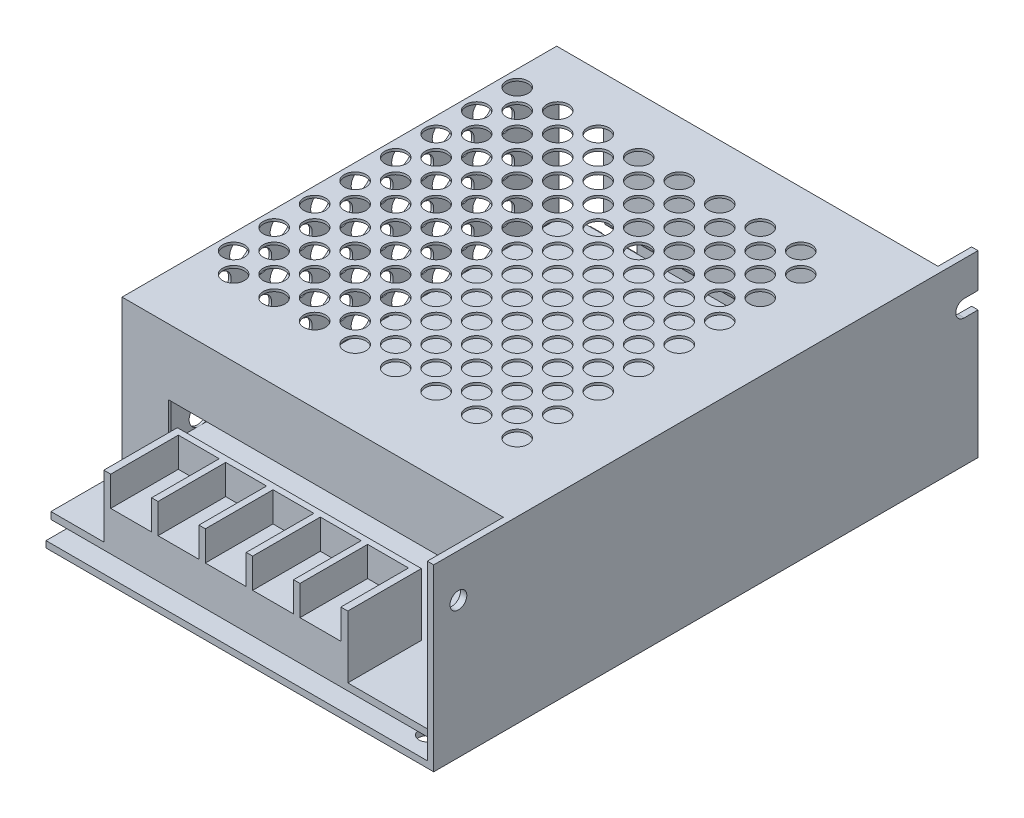
from build123d import *

# Parameters (mm, degrees)
BASE_BOSS_EXTRUDE1_DEPTH                     = 110.2
SKETCH2_R                                    = 1.7
MOUNTING_HOLES_SIDE_CUT_EXTRUDE1_DEPTH       = 1.3
SKETCH3_R                                    = 1.7
MOUNTING_HOLES_BOTTOM_CUT_EXTRUDE2_DEPTH     = 1.3
HEATSINK_BOSS_EXTRUDE2_DEPTH                 = 66.4
CHASSI_BOSS_EXTRUDE3_DEPTH                   = 88
CHASSI_FRONT_BOSS_EXTRUDE4_DEPTH             = 0.5
SKETCH7_W                                    = 76.7
SKETCH7_H                                    = 104.5
PCB_BOSS_EXTRUDE5_DEPTH                      = 1.4
SKETCH8_W                                    = 49.4
SKETCH8_H                                    = 14.9
CONNECTOR_HOUSING_BOSS_EXTRUDE6_DEPTH        = 12.6
SKETCH9_W                                    = 8.28
SKETCH9_H                                    = 13.7
CONNECTOR_SCREW_CUT_EXTRUDE3_DEPTH           = 6
SKETCH10_R                                   = 2.2
CHASSI_VENTING_HOLES_TOP_CUT_EXTRUDE5_DEPTH  = 0.5
SKETCH11_R                                   = 2.2
CHASSI_VENTING_HOLES_SIDE_CUT_EXTRUDE6_DEPTH = 0.5


with BuildPart() as part:
    # Sketch1 → Base Boss-Extrude1 (new body)
    with BuildSketch(Plane.XY):
        Polygon((0, 0), (0, 36.3), (-1.3, 36.3), (-1.3, 1.3), (-78.5, 1.3), (-78.5, 0), align=None)
    extrude(amount=-BASE_BOSS_EXTRUDE1_DEPTH)

    # Sketch2 → Mounting Holes Side Cut-Extrude1 (cut)
    with BuildSketch(Plane.ZY.offset(1.3)):
        with Locations(Location((-5, 27.6, 0), (0, 0, 270))):
            Circle(SKETCH2_R)
        with BuildLine():
            Line((-110.2, 29.3), (-107.4, 29.3))
            ThreePointArc((-107.4, 29.3), (-105.7, 27.6), (-107.4, 25.9))
            Line((-107.4, 25.9), (-110.2, 25.9))
            Line((-110.2, 25.9), (-110.2, 29.3))
        make_face()
    extrude(amount=-MOUNTING_HOLES_SIDE_CUT_EXTRUDE1_DEPTH, mode=Mode.SUBTRACT)

    # Sketch3 → Mounting Holes Bottom Cut-Extrude2 (cut)
    with BuildSketch(Plane(origin=(0, 1.3, 0), x_dir=(1, 0, 0), z_dir=(0, 1, 0))):
        with Locations(Location((-5.8, 4.5, 0), (0, 0, 180))):
            Circle(SKETCH3_R)
        with BuildLine():
            Line((-72.7, 108.5), (-72.7, 110.2))
            Line((-72.7, 110.2), (-76.1, 110.2))
            Line((-76.1, 110.2), (-76.1, 108.5))
            ThreePointArc((-76.1, 108.5), (-74.4, 106.8), (-72.7, 108.5))
        make_face()
    extrude(amount=-MOUNTING_HOLES_BOTTOM_CUT_EXTRUDE2_DEPTH, mode=Mode.SUBTRACT)

    # Sketch4 → Heatsink Boss-Extrude2 (add)
    with BuildSketch(Plane.ZY.offset(1.3)):
        with BuildLine():
            Line((-110.2, 1.3), (-108.9, 1.3))
            Line((-108.9, 1.3), (-108.9, 8.3))
            ThreePointArc((-108.9, 8.3), (-108.781448236, 8.649242235), (-108.474789595, 8.854144988))
            Line((-108.474789595, 8.854144988), (-103.488745646, 10.190151438))
            ThreePointArc((-103.488745646, 10.190151438), (-102.487192422, 10.859367907), (-102.1, 12))
            Line((-102.1, 12), (-102.1, 36.3))
            Line((-102.1, 36.3), (-103.4, 36.3))
            Line((-103.4, 36.3), (-103.4, 12))
            ThreePointArc((-103.4, 12), (-103.518551764, 11.650757765), (-103.825210405, 11.445855012))
            Line((-103.825210405, 11.445855012), (-108.811254354, 10.109848562))
            ThreePointArc((-108.811254354, 10.109848562), (-109.812807578, 9.440632093), (-110.2, 8.3))
            Line((-110.2, 8.3), (-110.2, 1.3))
        make_face()
    extrude(amount=HEATSINK_BOSS_EXTRUDE2_DEPTH)

    # Sketch5 → Chassi Boss-Extrude3 (add)
    with BuildSketch(Plane(origin=(0, 0, -103.4), x_dir=(-1, 0, 0), z_dir=(0, 0, -1))):
        Polygon((1.3, 36.3), (78.5, 36.3), (78.5, 1.3), (78, 1.3), (78, 35.8), (1.3, 35.8), align=None)
    extrude(amount=-CHASSI_BOSS_EXTRUDE3_DEPTH)

    # Sketch6 → Chassi Front Boss-Extrude4 (add)
    with BuildSketch(Plane.XY.offset(-15.4)):
        Polygon((-1.3, 36.3), (-78.5, 36.3), (-78.5, 1.3), (-69.1, 1.3), (-69.1, 23), (-1.3, 23), align=None)
    extrude(amount=-CHASSI_FRONT_BOSS_EXTRUDE4_DEPTH)

    # Sketch7 → PCB Boss-Extrude5 (add)
    with BuildSketch(Plane(origin=(0, 5, 0), x_dir=(1, 0, 0), z_dir=(0, 1, 0))):
        with Locations((-39.65, 52.75)):
            Rectangle(SKETCH7_W, SKETCH7_H)
    extrude(amount=PCB_BOSS_EXTRUDE5_DEPTH)

    # Sketch8 → Connector Housing Boss-Extrude6 (add)
    with BuildSketch(Plane(origin=(0, 6.4, 0), x_dir=(1, 0, 0), z_dir=(0, 1, 0))):
        with Locations((-42.6, 7.95)):
            Rectangle(SKETCH8_W, SKETCH8_H)
    extrude(amount=CONNECTOR_HOUSING_BOSS_EXTRUDE6_DEPTH)

    # Sketch9 → Connector Screw Cut-Extrude3 (cut)
    with BuildSketch(Plane(origin=(0, 19, 0), x_dir=(1, 0, 0), z_dir=(0, 1, 0))):
        with Locations((-61.76, 7.35)):
            Rectangle(SKETCH9_W, SKETCH9_H)
        with Locations((-52.18, 7.35)):
            Rectangle(SKETCH9_W, SKETCH9_H)
        with Locations((-42.6, 7.35)):
            Rectangle(SKETCH9_W, SKETCH9_H)
        with Locations((-33.02, 7.35)):
            Rectangle(SKETCH9_W, SKETCH9_H)
        with Locations((-23.44, 7.35)):
            Rectangle(SKETCH9_W, SKETCH9_H)
    extrude(amount=-CONNECTOR_SCREW_CUT_EXTRUDE3_DEPTH, mode=Mode.SUBTRACT)

    # Sketch10 → Chassi Venting Holes Top Cut-Extrude5 (cut)
    with BuildSketch(Plane(origin=(0, 36.3, 0), x_dir=(1, 0, 0), z_dir=(0, 1, 0))):
        with Locations(Location((-75.3, 92.2, 0), (0, 0, 270))):
            Circle(SKETCH10_R)
        with Locations(Location((-71.198780669, 88.098780669, 0), (0, 0, 270))):
            Circle(SKETCH10_R)
        with Locations(Location((-67.097561338, 92.2, 0), (0, 0, 270))):
            Circle(SKETCH10_R)
        with Locations(Location((-62.996342007, 88.098780669, 0), (0, 0, 270))):
            Circle(SKETCH10_R)
        with Locations(Location((-58.895122676, 92.2, 0), (0, 0, 270))):
            Circle(SKETCH10_R)
        with Locations(Location((-54.793903346, 88.098780669, 0), (0, 0, 270))):
            Circle(SKETCH10_R)
        with Locations(Location((-50.692684015, 92.2, 0), (0, 0, 270))):
            Circle(SKETCH10_R)
        with Locations(Location((-46.591464684, 88.098780669, 0), (0, 0, 270))):
            Circle(SKETCH10_R)
        with Locations(Location((-42.490245353, 92.2, 0), (0, 0, 270))):
            Circle(SKETCH10_R)
        with Locations(Location((-38.389026022, 88.098780669, 0), (0, 0, 270))):
            Circle(SKETCH10_R)
        with Locations(Location((-34.287806691, 92.2, 0), (0, 0, 270))):
            Circle(SKETCH10_R)
        with Locations(Location((-30.18658736, 88.098780669, 0), (0, 0, 270))):
            Circle(SKETCH10_R)
        with Locations(Location((-26.085368029, 92.2, 0), (0, 0, 270))):
            Circle(SKETCH10_R)
        with Locations(Location((-21.984148699, 88.098780669, 0), (0, 0, 270))):
            Circle(SKETCH10_R)
        with Locations(Location((-67.097561338, 83.997561338, 0), (0, 0, 270))):
            Circle(SKETCH10_R)
        with Locations(Location((-62.996342007, 79.896342007, 0), (0, 0, 270))):
            Circle(SKETCH10_R)
        with Locations(Location((-58.895122676, 83.997561338, 0), (0, 0, 270))):
            Circle(SKETCH10_R)
        with Locations(Location((-54.793903346, 79.896342007, 0), (0, 0, 270))):
            Circle(SKETCH10_R)
        with Locations(Location((-50.692684015, 83.997561338, 0), (0, 0, 270))):
            Circle(SKETCH10_R)
        with Locations(Location((-46.591464684, 79.896342007, 0), (0, 0, 270))):
            Circle(SKETCH10_R)
        with Locations(Location((-42.490245353, 83.997561338, 0), (0, 0, 270))):
            Circle(SKETCH10_R)
        with Locations(Location((-38.389026022, 79.896342007, 0), (0, 0, 270))):
            Circle(SKETCH10_R)
        with Locations(Location((-34.287806691, 83.997561338, 0), (0, 0, 270))):
            Circle(SKETCH10_R)
        with Locations(Location((-30.18658736, 79.896342007, 0), (0, 0, 270))):
            Circle(SKETCH10_R)
        with Locations(Location((-26.085368029, 83.997561338, 0), (0, 0, 270))):
            Circle(SKETCH10_R)
        with Locations(Location((-21.984148699, 79.896342007, 0), (0, 0, 270))):
            Circle(SKETCH10_R)
        with Locations(Location((-67.097561338, 75.795122676, 0), (0, 0, 270))):
            Circle(SKETCH10_R)
        with Locations(Location((-62.996342007, 71.693903346, 0), (0, 0, 270))):
            Circle(SKETCH10_R)
        with Locations(Location((-58.895122676, 75.795122676, 0), (0, 0, 270))):
            Circle(SKETCH10_R)
        with Locations(Location((-54.793903346, 71.693903346, 0), (0, 0, 270))):
            Circle(SKETCH10_R)
        with Locations(Location((-50.692684015, 75.795122676, 0), (0, 0, 270))):
            Circle(SKETCH10_R)
        with Locations(Location((-46.591464684, 71.693903346, 0), (0, 0, 270))):
            Circle(SKETCH10_R)
        with Locations(Location((-42.490245353, 75.795122676, 0), (0, 0, 270))):
            Circle(SKETCH10_R)
        with Locations(Location((-38.389026022, 71.693903346, 0), (0, 0, 270))):
            Circle(SKETCH10_R)
        with Locations(Location((-34.287806691, 75.795122676, 0), (0, 0, 270))):
            Circle(SKETCH10_R)
        with Locations(Location((-30.18658736, 71.693903346, 0), (0, 0, 270))):
            Circle(SKETCH10_R)
        with Locations(Location((-26.085368029, 75.795122676, 0), (0, 0, 270))):
            Circle(SKETCH10_R)
        with Locations(Location((-21.984148699, 71.693903346, 0), (0, 0, 270))):
            Circle(SKETCH10_R)
        with Locations(Location((-67.097561338, 67.592684015, 0), (0, 0, 270))):
            Circle(SKETCH10_R)
        with Locations(Location((-62.996342007, 63.491464684, 0), (0, 0, 270))):
            Circle(SKETCH10_R)
        with Locations(Location((-58.895122676, 67.592684015, 0), (0, 0, 270))):
            Circle(SKETCH10_R)
        with Locations(Location((-54.793903346, 63.491464684, 0), (0, 0, 270))):
            Circle(SKETCH10_R)
        with Locations(Location((-50.692684015, 67.592684015, 0), (0, 0, 270))):
            Circle(SKETCH10_R)
        with Locations(Location((-46.591464684, 63.491464684, 0), (0, 0, 270))):
            Circle(SKETCH10_R)
        with Locations(Location((-42.490245353, 67.592684015, 0), (0, 0, 270))):
            Circle(SKETCH10_R)
        with Locations(Location((-38.389026022, 63.491464684, 0), (0, 0, 270))):
            Circle(SKETCH10_R)
        with Locations(Location((-34.287806691, 67.592684015, 0), (0, 0, 270))):
            Circle(SKETCH10_R)
        with Locations(Location((-30.18658736, 63.491464684, 0), (0, 0, 270))):
            Circle(SKETCH10_R)
        with Locations(Location((-26.085368029, 67.592684015, 0), (0, 0, 270))):
            Circle(SKETCH10_R)
        with Locations(Location((-21.984148699, 63.491464684, 0), (0, 0, 270))):
            Circle(SKETCH10_R)
        with Locations(Location((-67.097561338, 59.390245353, 0), (0, 0, 270))):
            Circle(SKETCH10_R)
        with Locations(Location((-62.996342007, 55.289026022, 0), (0, 0, 270))):
            Circle(SKETCH10_R)
        with Locations(Location((-58.895122676, 59.390245353, 0), (0, 0, 270))):
            Circle(SKETCH10_R)
        with Locations(Location((-54.793903346, 55.289026022, 0), (0, 0, 270))):
            Circle(SKETCH10_R)
        with Locations(Location((-50.692684015, 59.390245353, 0), (0, 0, 270))):
            Circle(SKETCH10_R)
        with Locations(Location((-46.591464684, 55.289026022, 0), (0, 0, 270))):
            Circle(SKETCH10_R)
        with Locations(Location((-42.490245353, 59.390245353, 0), (0, 0, 270))):
            Circle(SKETCH10_R)
        with Locations(Location((-38.389026022, 55.289026022, 0), (0, 0, 270))):
            Circle(SKETCH10_R)
        with Locations(Location((-34.287806691, 59.390245353, 0), (0, 0, 270))):
            Circle(SKETCH10_R)
        with Locations(Location((-30.18658736, 55.289026022, 0), (0, 0, 270))):
            Circle(SKETCH10_R)
        with Locations(Location((-26.085368029, 59.390245353, 0), (0, 0, 270))):
            Circle(SKETCH10_R)
        with Locations(Location((-21.984148699, 55.289026022, 0), (0, 0, 270))):
            Circle(SKETCH10_R)
        with Locations(Location((-67.097561338, 51.187806691, 0), (0, 0, 270))):
            Circle(SKETCH10_R)
        with Locations(Location((-62.996342007, 47.08658736, 0), (0, 0, 270))):
            Circle(SKETCH10_R)
        with Locations(Location((-58.895122676, 51.187806691, 0), (0, 0, 270))):
            Circle(SKETCH10_R)
        with Locations(Location((-54.793903346, 47.08658736, 0), (0, 0, 270))):
            Circle(SKETCH10_R)
        with Locations(Location((-50.692684015, 51.187806691, 0), (0, 0, 270))):
            Circle(SKETCH10_R)
        with Locations(Location((-46.591464684, 47.08658736, 0), (0, 0, 270))):
            Circle(SKETCH10_R)
        with Locations(Location((-42.490245353, 51.187806691, 0), (0, 0, 270))):
            Circle(SKETCH10_R)
        with Locations(Location((-38.389026022, 47.08658736, 0), (0, 0, 270))):
            Circle(SKETCH10_R)
        with Locations(Location((-34.287806691, 51.187806691, 0), (0, 0, 270))):
            Circle(SKETCH10_R)
        with Locations(Location((-30.18658736, 47.08658736, 0), (0, 0, 270))):
            Circle(SKETCH10_R)
        with Locations(Location((-26.085368029, 51.187806691, 0), (0, 0, 270))):
            Circle(SKETCH10_R)
        with Locations(Location((-21.984148699, 47.08658736, 0), (0, 0, 270))):
            Circle(SKETCH10_R)
        with Locations(Location((-67.097561338, 42.985368029, 0), (0, 0, 270))):
            Circle(SKETCH10_R)
        with Locations(Location((-62.996342007, 38.884148699, 0), (0, 0, 270))):
            Circle(SKETCH10_R)
        with Locations(Location((-58.895122676, 42.985368029, 0), (0, 0, 270))):
            Circle(SKETCH10_R)
        with Locations(Location((-54.793903346, 38.884148699, 0), (0, 0, 270))):
            Circle(SKETCH10_R)
        with Locations(Location((-50.692684015, 42.985368029, 0), (0, 0, 270))):
            Circle(SKETCH10_R)
        with Locations(Location((-46.591464684, 38.884148699, 0), (0, 0, 270))):
            Circle(SKETCH10_R)
        with Locations(Location((-42.490245353, 42.985368029, 0), (0, 0, 270))):
            Circle(SKETCH10_R)
        with Locations(Location((-38.389026022, 38.884148699, 0), (0, 0, 270))):
            Circle(SKETCH10_R)
        with Locations(Location((-34.287806691, 42.985368029, 0), (0, 0, 270))):
            Circle(SKETCH10_R)
        with Locations(Location((-30.18658736, 38.884148699, 0), (0, 0, 270))):
            Circle(SKETCH10_R)
        with Locations(Location((-26.085368029, 42.985368029, 0), (0, 0, 270))):
            Circle(SKETCH10_R)
        with Locations(Location((-21.984148699, 38.884148699, 0), (0, 0, 270))):
            Circle(SKETCH10_R)
        with Locations(Location((-75.3, 83.997561338, 0), (0, 0, 270))):
            Circle(SKETCH10_R)
        with Locations(Location((-71.198780669, 79.896342007, 0), (0, 0, 270))):
            Circle(SKETCH10_R)
        with Locations(Location((-75.3, 75.795122676, 0), (0, 0, 270))):
            Circle(SKETCH10_R)
        with Locations(Location((-71.198780669, 71.693903346, 0), (0, 0, 270))):
            Circle(SKETCH10_R)
        with Locations(Location((-75.3, 67.592684015, 0), (0, 0, 270))):
            Circle(SKETCH10_R)
        with Locations(Location((-71.198780669, 63.491464684, 0), (0, 0, 270))):
            Circle(SKETCH10_R)
        with Locations(Location((-75.3, 59.390245353, 0), (0, 0, 270))):
            Circle(SKETCH10_R)
        with Locations(Location((-71.198780669, 55.289026022, 0), (0, 0, 270))):
            Circle(SKETCH10_R)
        with Locations(Location((-75.3, 51.187806691, 0), (0, 0, 270))):
            Circle(SKETCH10_R)
        with Locations(Location((-71.198780669, 47.08658736, 0), (0, 0, 270))):
            Circle(SKETCH10_R)
        with Locations(Location((-75.3, 42.985368029, 0), (0, 0, 270))):
            Circle(SKETCH10_R)
        with Locations(Location((-71.198780669, 38.884148699, 0), (0, 0, 270))):
            Circle(SKETCH10_R)
        with Locations(Location((-75.3, 34.782929368, 0), (0, 0, 270))):
            Circle(SKETCH10_R)
        with Locations(Location((-71.198780669, 30.681710037, 0), (0, 0, 270))):
            Circle(SKETCH10_R)
        with Locations(Location((-67.097561338, 34.782929368, 0), (0, 0, 270))):
            Circle(SKETCH10_R)
        with Locations(Location((-62.996342007, 30.681710037, 0), (0, 0, 270))):
            Circle(SKETCH10_R)
        with Locations(Location((-58.895122676, 34.782929368, 0), (0, 0, 270))):
            Circle(SKETCH10_R)
        with Locations(Location((-54.793903346, 30.681710037, 0), (0, 0, 270))):
            Circle(SKETCH10_R)
        with Locations(Location((-50.692684015, 34.782929368, 0), (0, 0, 270))):
            Circle(SKETCH10_R)
        with Locations(Location((-46.591464684, 30.681710037, 0), (0, 0, 270))):
            Circle(SKETCH10_R)
        with Locations(Location((-42.490245353, 34.782929368, 0), (0, 0, 270))):
            Circle(SKETCH10_R)
        with Locations(Location((-38.389026022, 30.681710037, 0), (0, 0, 270))):
            Circle(SKETCH10_R)
        with Locations(Location((-34.287806691, 34.782929368, 0), (0, 0, 270))):
            Circle(SKETCH10_R)
        with Locations(Location((-30.18658736, 30.681710037, 0), (0, 0, 270))):
            Circle(SKETCH10_R)
        with Locations(Location((-26.085368029, 34.782929368, 0), (0, 0, 270))):
            Circle(SKETCH10_R)
        with Locations(Location((-21.984148699, 30.681710037, 0), (0, 0, 270))):
            Circle(SKETCH10_R)
        with Locations(Location((-17.882929368, 92.2, 0), (0, 0, 270))):
            Circle(SKETCH10_R)
        with Locations(Location((-13.781710037, 88.098780669, 0), (0, 0, 270))):
            Circle(SKETCH10_R)
        with Locations(Location((-17.882929368, 83.997561338, 0), (0, 0, 270))):
            Circle(SKETCH10_R)
        with Locations(Location((-13.781710037, 79.896342007, 0), (0, 0, 270))):
            Circle(SKETCH10_R)
        with Locations(Location((-17.882929368, 75.795122676, 0), (0, 0, 270))):
            Circle(SKETCH10_R)
        with Locations(Location((-13.781710037, 71.693903346, 0), (0, 0, 270))):
            Circle(SKETCH10_R)
        with Locations(Location((-17.882929368, 67.592684015, 0), (0, 0, 270))):
            Circle(SKETCH10_R)
        with Locations(Location((-13.781710037, 63.491464684, 0), (0, 0, 270))):
            Circle(SKETCH10_R)
        with Locations(Location((-17.882929368, 59.390245353, 0), (0, 0, 270))):
            Circle(SKETCH10_R)
        with Locations(Location((-13.781710037, 55.289026022, 0), (0, 0, 270))):
            Circle(SKETCH10_R)
        with Locations(Location((-17.882929368, 51.187806691, 0), (0, 0, 270))):
            Circle(SKETCH10_R)
        with Locations(Location((-13.781710037, 47.08658736, 0), (0, 0, 270))):
            Circle(SKETCH10_R)
        with Locations(Location((-17.882929368, 42.985368029, 0), (0, 0, 270))):
            Circle(SKETCH10_R)
        with Locations(Location((-13.781710037, 38.884148699, 0), (0, 0, 270))):
            Circle(SKETCH10_R)
        with Locations(Location((-17.882929368, 34.782929368, 0), (0, 0, 270))):
            Circle(SKETCH10_R)
        with Locations(Location((-13.781710037, 30.681710037, 0), (0, 0, 270))):
            Circle(SKETCH10_R)
    extrude(amount=-CHASSI_VENTING_HOLES_TOP_CUT_EXTRUDE5_DEPTH, mode=Mode.SUBTRACT)

    # Sketch11 → Chassi Venting Holes Side Cut-Extrude6 (cut)
    with BuildSketch(Plane.ZY.offset(78.5)):
        with Locations((-88.098780669, 33.1)):
            Circle(SKETCH11_R)
        with Locations((-92.2, 28.998780669)):
            Circle(SKETCH11_R)
        with Locations((-83.997561338, 28.998780669)):
            Circle(SKETCH11_R)
        with Locations((-79.896342007, 33.1)):
            Circle(SKETCH11_R)
        with Locations((-75.795122676, 28.998780669)):
            Circle(SKETCH11_R)
        with Locations((-71.693903346, 33.1)):
            Circle(SKETCH11_R)
        with Locations((-67.592684015, 28.998780669)):
            Circle(SKETCH11_R)
        with Locations((-63.491464684, 33.1)):
            Circle(SKETCH11_R)
        with Locations((-59.390245353, 28.998780669)):
            Circle(SKETCH11_R)
        with Locations((-55.289026022, 33.1)):
            Circle(SKETCH11_R)
        with Locations((-51.187806691, 28.998780669)):
            Circle(SKETCH11_R)
        with Locations((-47.08658736, 33.1)):
            Circle(SKETCH11_R)
        with Locations((-42.985368029, 28.998780669)):
            Circle(SKETCH11_R)
        with Locations((-38.884148699, 33.1)):
            Circle(SKETCH11_R)
        with Locations((-34.782929368, 28.998780669)):
            Circle(SKETCH11_R)
        with Locations((-30.681710037, 33.1)):
            Circle(SKETCH11_R)
        with Locations((-83.997561338, 20.796342007)):
            Circle(SKETCH11_R)
        with Locations((-79.896342007, 24.897561338)):
            Circle(SKETCH11_R)
        with Locations((-75.795122676, 20.796342007)):
            Circle(SKETCH11_R)
        with Locations((-71.693903346, 24.897561338)):
            Circle(SKETCH11_R)
        with Locations((-67.592684015, 20.796342007)):
            Circle(SKETCH11_R)
        with Locations((-63.491464684, 24.897561338)):
            Circle(SKETCH11_R)
        with Locations((-59.390245353, 20.796342007)):
            Circle(SKETCH11_R)
        with Locations((-55.289026022, 24.897561338)):
            Circle(SKETCH11_R)
        with Locations((-51.187806691, 20.796342007)):
            Circle(SKETCH11_R)
        with Locations((-47.08658736, 24.897561338)):
            Circle(SKETCH11_R)
        with Locations((-42.985368029, 20.796342007)):
            Circle(SKETCH11_R)
        with Locations((-38.884148699, 24.897561338)):
            Circle(SKETCH11_R)
        with Locations((-34.782929368, 20.796342007)):
            Circle(SKETCH11_R)
        with Locations((-30.681710037, 24.897561338)):
            Circle(SKETCH11_R)
        with Locations((-83.997561338, 12.593903346)):
            Circle(SKETCH11_R)
        with Locations((-79.896342007, 16.695122676)):
            Circle(SKETCH11_R)
        with Locations((-75.795122676, 12.593903346)):
            Circle(SKETCH11_R)
        with Locations((-71.693903346, 16.695122676)):
            Circle(SKETCH11_R)
        with Locations((-67.592684015, 12.593903346)):
            Circle(SKETCH11_R)
        with Locations((-63.491464684, 16.695122676)):
            Circle(SKETCH11_R)
        with Locations((-59.390245353, 12.593903346)):
            Circle(SKETCH11_R)
        with Locations((-55.289026022, 16.695122676)):
            Circle(SKETCH11_R)
        with Locations((-51.187806691, 12.593903346)):
            Circle(SKETCH11_R)
        with Locations((-47.08658736, 16.695122676)):
            Circle(SKETCH11_R)
        with Locations((-42.985368029, 12.593903346)):
            Circle(SKETCH11_R)
        with Locations((-38.884148699, 16.695122676)):
            Circle(SKETCH11_R)
        with Locations((-34.782929368, 12.593903346)):
            Circle(SKETCH11_R)
        with Locations((-30.681710037, 16.695122676)):
            Circle(SKETCH11_R)
        with Locations((-83.997561338, 4.391464684)):
            Circle(SKETCH11_R)
        with Locations((-79.896342007, 8.492684015)):
            Circle(SKETCH11_R)
        with Locations((-75.795122676, 4.391464684)):
            Circle(SKETCH11_R)
        with Locations((-71.693903346, 8.492684015)):
            Circle(SKETCH11_R)
        with Locations((-67.592684015, 4.391464684)):
            Circle(SKETCH11_R)
        with Locations((-63.491464684, 8.492684015)):
            Circle(SKETCH11_R)
        with Locations((-59.390245353, 4.391464684)):
            Circle(SKETCH11_R)
        with Locations((-55.289026022, 8.492684015)):
            Circle(SKETCH11_R)
        with Locations((-51.187806691, 4.391464684)):
            Circle(SKETCH11_R)
        with Locations((-47.08658736, 8.492684015)):
            Circle(SKETCH11_R)
        with Locations((-42.985368029, 4.391464684)):
            Circle(SKETCH11_R)
        with Locations((-38.884148699, 8.492684015)):
            Circle(SKETCH11_R)
        with Locations((-34.782929368, 4.391464684)):
            Circle(SKETCH11_R)
        with Locations((-30.681710037, 8.492684015)):
            Circle(SKETCH11_R)
        with Locations((-92.2, 20.796342007)):
            Circle(SKETCH11_R)
        with Locations((-88.098780669, 24.897561338)):
            Circle(SKETCH11_R)
        with Locations((-92.2, 12.593903346)):
            Circle(SKETCH11_R)
        with Locations((-88.098780669, 16.695122676)):
            Circle(SKETCH11_R)
        with Locations((-92.2, 4.391464684)):
            Circle(SKETCH11_R)
        with Locations((-88.098780669, 8.492684015)):
            Circle(SKETCH11_R)
    extrude(amount=-CHASSI_VENTING_HOLES_SIDE_CUT_EXTRUDE6_DEPTH, mode=Mode.SUBTRACT)


solid = part.part
